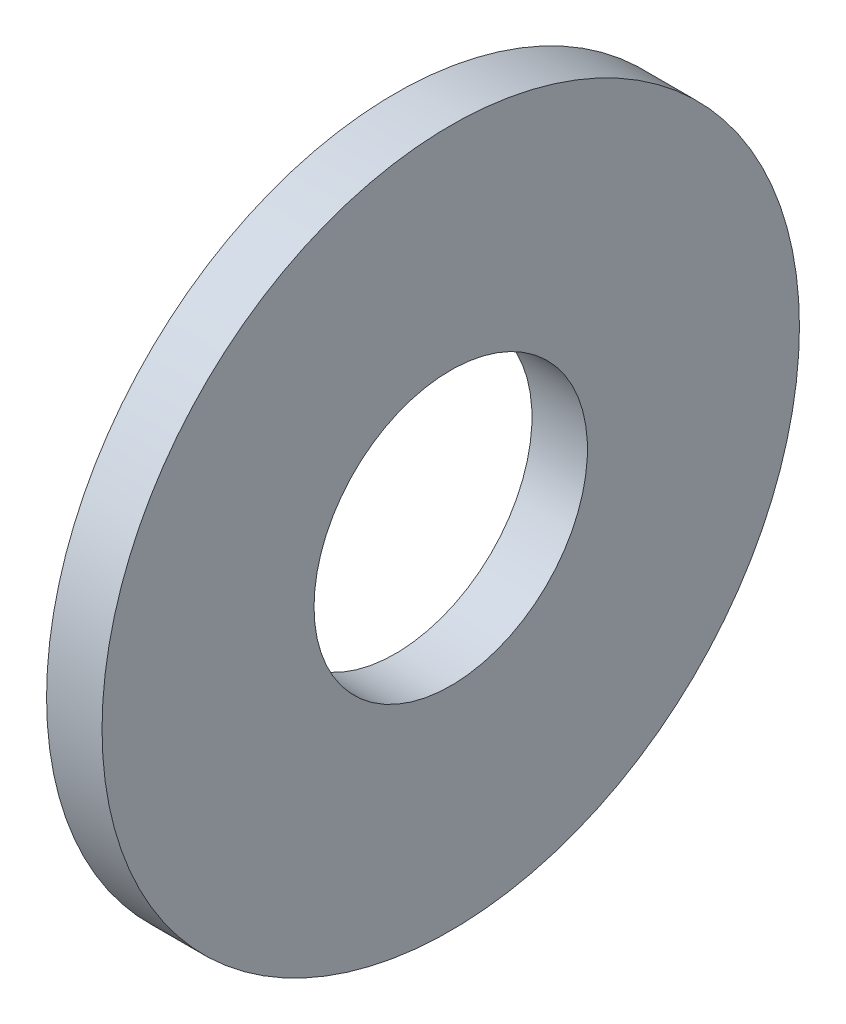
from build123d import *

# Parameters (mm, degrees)
SKETCH1_W = 3.5
SKETCH1_H = 13.375


with BuildPart() as part:
    # Sketch1 → Base-Revolve (revolve)
    with BuildSketch(Plane.XY):
        with Locations((-1.75, 15.3125)):
            Rectangle(SKETCH1_W, SKETCH1_H)
    revolve(axis=Axis((-34.925, 0, 0), (1, 0, 0)))


solid = part.part
